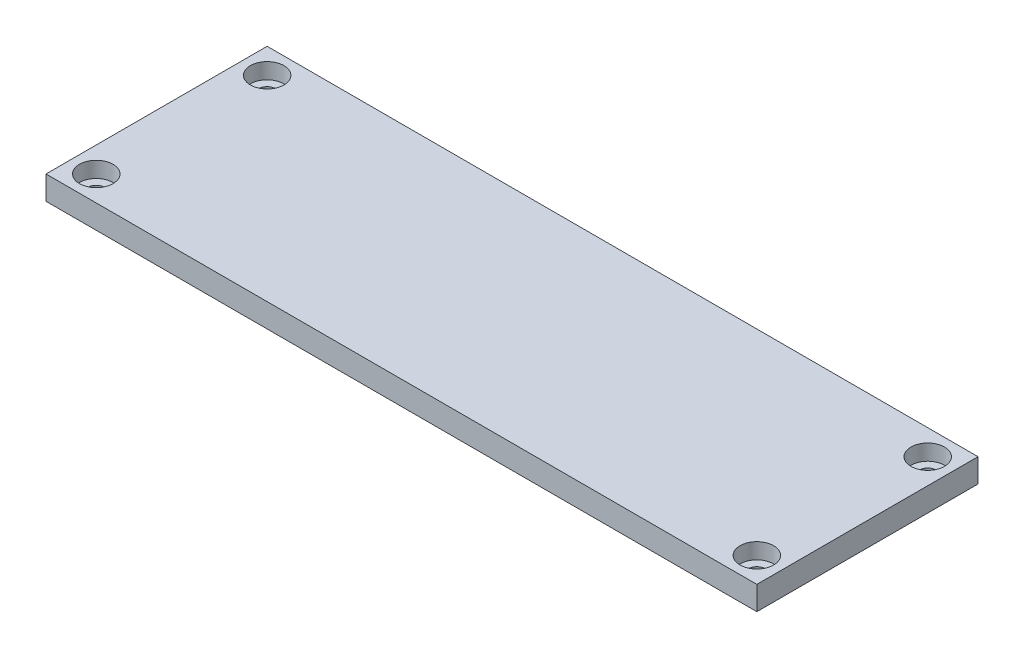
from build123d import *

# Parameters (mm, degrees)
SKETCH2_W           = 90
SKETCH2_H           = 28
BOSS_EXTRUDE1_DEPTH = 3
SKETCH3_R           = 2.125
SKETCH3_R_2         = 1.075
CUT_EXTRUDE1_DEPTH  = 2
SKETCH5_R           = 1.075
CUT_EXTRUDE3_DEPTH  = 4


with BuildPart() as part:
    # Sketch2 → Boss-Extrude1 (new body)
    with BuildSketch(Plane(origin=(0, 0, 0), x_dir=(1, 0, 0), z_dir=(0, 1, 0))):
        with Locations((10.225806452, 5.983870968)):
            Rectangle(SKETCH2_W, SKETCH2_H)
    extrude(amount=BOSS_EXTRUDE1_DEPTH)

    # Sketch3 → Cut-Extrude1 (cut)
    # profile 1 of 4: a face of its own
    with BuildSketch(Plane(origin=(0, 3, 0), x_dir=(1, 0, 0), z_dir=(0, 1, 0))):
        with Locations((-31.592213033, 16.801890452)):
            Circle(SKETCH3_R)
        with Locations((-31.592213033, 16.801890452)):
            Circle(SKETCH3_R_2, mode=Mode.SUBTRACT)
    # profile 2 of 4: a face of its own
    with BuildSketch(Plane(origin=(0, 3, 0), x_dir=(1, 0, 0), z_dir=(0, 1, 0))):
        with Locations((-31.592213033, -4.834148517)):
            Circle(SKETCH3_R)
        with Locations((-31.592213033, -4.834148517)):
            Circle(SKETCH3_R_2, mode=Mode.SUBTRACT)
    # profile 3 of 4: a face of its own
    with BuildSketch(Plane(origin=(0, 3, 0), x_dir=(1, 0, 0), z_dir=(0, 1, 0))):
        with Locations((52.043825936, -4.834148517)):
            Circle(SKETCH3_R)
        with Locations((52.043825936, -4.834148517)):
            Circle(SKETCH3_R_2, mode=Mode.SUBTRACT)
    # profile 4 of 4: a face of its own
    with BuildSketch(Plane(origin=(0, 3, 0), x_dir=(1, 0, 0), z_dir=(0, 1, 0))):
        with Locations((52.043825936, 16.801890452)):
            Circle(SKETCH3_R)
        with Locations((52.043825936, 16.801890452)):
            Circle(SKETCH3_R_2, mode=Mode.SUBTRACT)
    extrude(amount=-CUT_EXTRUDE1_DEPTH, mode=Mode.SUBTRACT)

    # Sketch5 → Cut-Extrude3 (cut)
    with BuildSketch(Plane(origin=(0, 3, 0), x_dir=(1, 0, 0), z_dir=(0, 1, 0))):
        with Locations((-31.592213033, 16.801890452)):
            Circle(SKETCH5_R)
        with Locations((-31.592213033, -4.834148517)):
            Circle(SKETCH5_R)
        with Locations((52.043825936, -4.834148517)):
            Circle(SKETCH5_R)
        with Locations((52.043825936, 16.801890452)):
            Circle(SKETCH5_R)
    extrude(amount=-CUT_EXTRUDE3_DEPTH, mode=Mode.SUBTRACT)


solid = part.part
